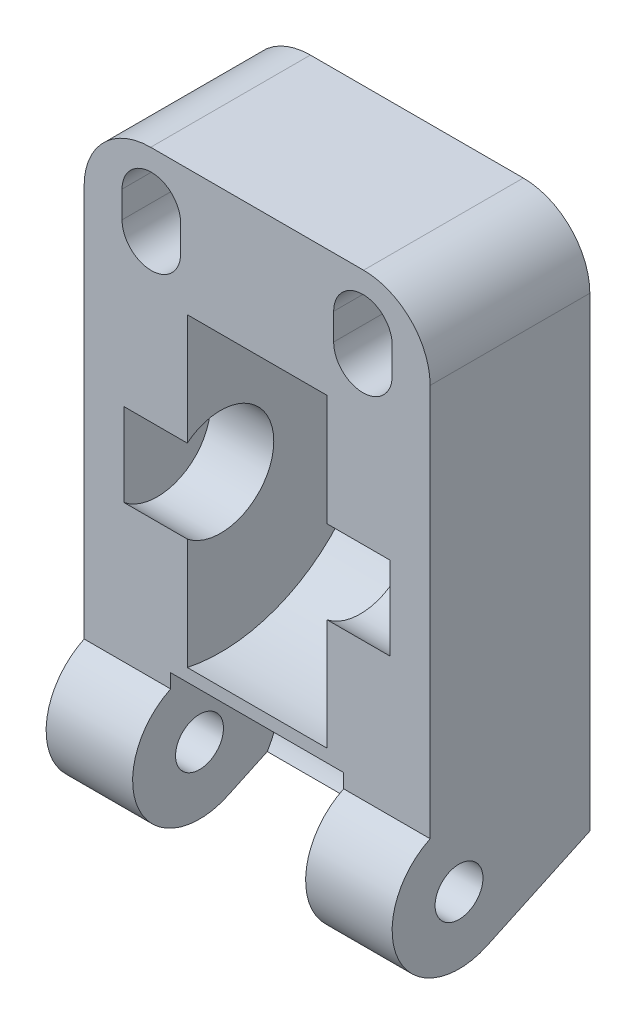
from build123d import *

# Parameters (mm, degrees)
SKETCH1_R           = 1.8
BOSS_EXTRUDE1_DEPTH = 13
SKETCH2_R           = 4
CUT_EXTRUDE1_DEPTH  = 10
SKETCH3_R           = 11.75
CUT_EXTRUDE2_DEPTH  = 5.25
SKETCH4_R           = 6
CUT_EXTRUDE3_DEPTH  = 6.5
CUT_EXTRUDE6_DEPTH  = 45.606330279
FILLET1_R           = 5


with BuildPart() as part:
    # Sketch1 → Boss-Extrude1 (new, symmetric)
    with BuildSketch(Plane(origin=(0, 0, 0), x_dir=(0, 0, -1), z_dir=(1, 0, 0))):
        with BuildLine():
            Line((0, 0), (0, 40))
            Line((0, 40), (-12, 40))
            Line((-12, 40), (-12, 5.5))
            ThreePointArc((-12, 5.5), (-14.374806505, -1.183390223), (-7.70361619, -3.592255225))
            Line((-7.70361619, -3.592255225), (0, 0))
        make_face()
        with Locations((-9.828619755, 0.964829626)):
            Circle(SKETCH1_R, mode=Mode.SUBTRACT)
    extrude(amount=BOSS_EXTRUDE1_DEPTH, both=True)

    # Sketch2 → Cut-Extrude1 (cut, symmetric)
    with BuildSketch(Plane(origin=(0, 0, 0), x_dir=(0, 0, -1), z_dir=(1, 0, 0))):
        with Locations((-9.5, 19)):
            Circle(SKETCH2_R)
    extrude(amount=CUT_EXTRUDE1_DEPTH, both=True, mode=Mode.SUBTRACT)

    # Sketch3 → Cut-Extrude2 (cut, symmetric)
    with BuildSketch(Plane(origin=(0, 0, 0), x_dir=(0, 0, -1), z_dir=(1, 0, 0))):
        with Locations((-9.5, 19)):
            Circle(SKETCH3_R)
    extrude(amount=CUT_EXTRUDE2_DEPTH, both=True, mode=Mode.SUBTRACT)

    # Sketch4 → Cut-Extrude3 (cut, symmetric)
    with BuildSketch(Plane(origin=(0, 0, 0), x_dir=(0, 0, -1), z_dir=(1, 0, 0))):
        with Locations((-9.828619755, 0.964829626)):
            Circle(SKETCH4_R)
    extrude(amount=CUT_EXTRUDE3_DEPTH, both=True, mode=Mode.SUBTRACT)

    # Sketch7 → Cut-Extrude6 (cut, through all)
    with BuildSketch(Plane(origin=(0, 0, 0), x_dir=(-1, 0, 0), z_dir=(0, 0, -1))):
        with BuildLine():
            Line((-5.75, 36.2), (-5.75, 34.2))
            ThreePointArc((-5.75, 34.2), (-7.95, 32), (-10.15, 34.2))
            Line((-10.15, 34.2), (-10.15, 36.2))
            ThreePointArc((-10.15, 36.2), (-7.95, 38.4), (-5.75, 36.2))
        make_face()
        with BuildLine():
            Line((10.15, 36.2), (10.15, 34.2))
            ThreePointArc((10.15, 34.2), (7.95, 32), (5.75, 34.2))
            Line((5.75, 34.2), (5.75, 36.2))
            ThreePointArc((5.75, 36.2), (7.95, 38.4), (10.15, 36.2))
        make_face()
    extrude(amount=-CUT_EXTRUDE6_DEPTH, mode=Mode.SUBTRACT)

    # Fillet1
    fillet1_edges = [part.edges().sort_by_distance(p)[0] for p in [
        (-13, 40, 6),
        (13, 40, 6),
    ]]
    fillet(fillet1_edges, radius=FILLET1_R)


solid = part.part
